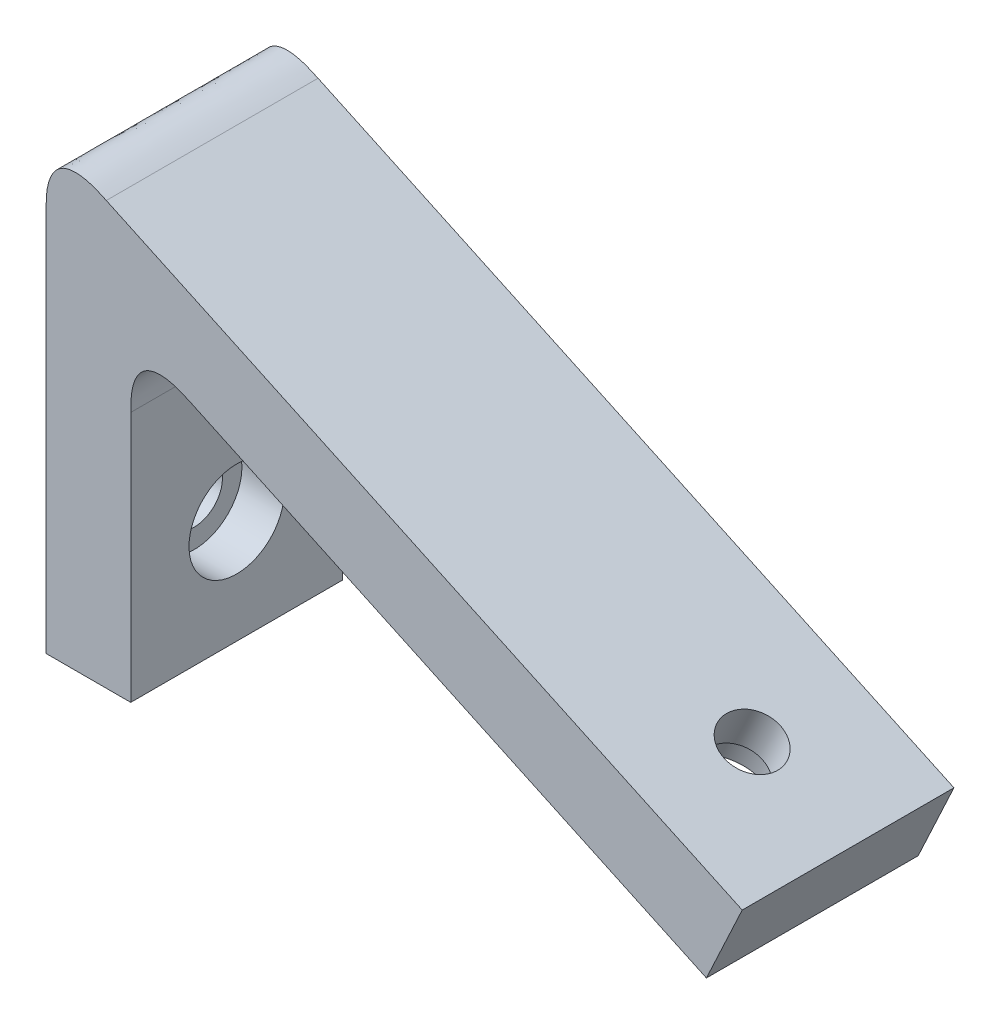
from build123d import *

# Parameters (mm, degrees)
BOSS_EXTRUDE1_DEPTH         = 25.4
F_1_4_CLEARANCE_HOLE1_D     = 6.7564
F_1_4_CLEARANCE_HOLE1_DEPTH = 10.16
F_1_4_CLEARANCE_HOLE1_TIP   = 2.029827343
F_1_4_CLEARANCE_HOLE2_D     = 6.7564
F_1_4_CLEARANCE_HOLE2_DEPTH = 10.16
F_1_4_CLEARANCE_HOLE2_TIP   = 2.029827343
SKETCH8_R                   = 5.715
CUT_EXTRUDE1_DEPTH          = 5.08
SKETCH9_R                   = 5.715
CUT_EXTRUDE2_DEPTH          = 5.08


with BuildPart() as part:
    # Sketch1 → Boss-Extrude1 (new body)
    with BuildSketch(Plane.XY):
        Polygon((10.16, 0), (0, 0), (0, 54.048005464), (83.514454911, 15.104575572), (79.220653372, 5.896488455), (10.16, 38.1), align=None)
    extrude(amount=BOSS_EXTRUDE1_DEPTH)

    # 1/4 Clearance Hole1
    with Locations(Plane.ZY):
        with Locations((12.7, 12.7)):
            Hole(F_1_4_CLEARANCE_HOLE1_D / 2, depth=F_1_4_CLEARANCE_HOLE1_DEPTH)
            with Locations((0, 0, -(F_1_4_CLEARANCE_HOLE1_DEPTH + F_1_4_CLEARANCE_HOLE1_TIP / 2))):  # 118° drill point
                Cone(0, F_1_4_CLEARANCE_HOLE1_D / 2, F_1_4_CLEARANCE_HOLE1_TIP, mode=Mode.SUBTRACT)

    # 1/4 Clearance Hole2
    with Locations(Plane(origin=(20.701587123, 44.394696852, 0), x_dir=(0.9063077870366483, -0.42261826174070316, 0), z_dir=(0.42261826174070316, 0.9063077870366483, 0))):
        with Locations((56.606331344, -12.7)):
            Hole(F_1_4_CLEARANCE_HOLE2_D / 2, depth=F_1_4_CLEARANCE_HOLE2_DEPTH)
            with Locations((0, 0, -(F_1_4_CLEARANCE_HOLE2_DEPTH + F_1_4_CLEARANCE_HOLE2_TIP / 2))):  # 118° drill point
                Cone(0, F_1_4_CLEARANCE_HOLE2_D / 2, F_1_4_CLEARANCE_HOLE2_TIP, mode=Mode.SUBTRACT)

    # Fillet1
    # a fillet whose section is not a circle: 5.08 mm, written as the material it adds along each edge (its section moved 0.00015 mm through the faces so that the kernel can cut it)
    with BuildSketch(Plane(origin=(10.16, 38.1, 0), x_dir=(0.9063157368032501, -0.4226012129925586, 0), z_dir=(0, 0, 1))) as fillet1_piece_1:
        with BuildLine():
            add(Edge.make_bspline([(7.974002733, 0), (6.748845081, 2.3047e-05), (5.523687428, 4.6093e-05), (2.911264627, -0.681700719), (1.848095837, -2.35047216), (2.334181059, -5.00626823), (2.851934169, -6.11664789), (3.369687279, -7.227027551)], knots=[0, 0, 0, 0, 0, 0, 0.5, 0.5, 1, 1, 1, 1, 1, 1], degree=5))
            Line((3.369687279, -7.227027551), (3.277605601, -7.269963835))
            ThreePointArc((3.277605601, -7.269963835), (1.592829935, -3.656418364), (-0.092081679, -0.042936283))
            Line((-0.092081679, -0.042936283), (1.911e-06, 0.1016))
            ThreePointArc((1.911e-06, 0.1016), (3.987003276, 0.101525), (7.974004644, 0.1016))
            Line((7.974004644, 0.1016), (7.974002733, 0))
        make_face()
    extrude(amount=25.4)
    # a fillet whose section is not a circle: 5.08 mm, written as the material it takes off along each edge (its section moved 0.00015 mm through the faces so that the kernel can cut it)
    with BuildSketch(Plane(origin=(0, 54.048005464, -19.935006833), x_dir=(-1.8811129744924416e-05, -0.9999999998230706, 0), z_dir=(0, 0, 1))) as fillet1_2_piece_1:
        with BuildLine():
            add(Edge.make_bspline([(7.974002733, 0), (6.748845081, -2.3047e-05), (5.523687428, -4.6093e-05), (2.911264627, 0.681700719), (1.848095837, 2.35047216), (2.334181059, 5.00626823), (2.851934169, 6.11664789), (3.369687279, 7.227027551)], knots=[0, 0, 0, 0, 0, 0, 0.5, 0.5, 1, 1, 1, 1, 1, 1], degree=5))
            Line((3.369687279, 7.227027551), (3.277605601, 7.269963835))
            ThreePointArc((3.277605601, 7.269963835), (1.592829935, 3.656418364), (-0.092081679, 0.042936283))
            Line((-0.092081679, 0.042936283), (1.911e-06, -0.1016))
            ThreePointArc((1.911e-06, -0.1016), (3.987003276, -0.101525), (7.974004644, -0.1016))
            Line((7.974004644, -0.1016), (7.974002733, 0))
        make_face()
    extrude(amount=65.270013666, mode=Mode.SUBTRACT)

    # Sketch8 → Cut-Extrude1 (cut)
    with BuildSketch(Plane(origin=(16.407785584, 35.186609736, 0), x_dir=(0.906307787036648, -0.42261826174070366, 0), z_dir=(-0.4226182617407036, -0.9063077870366479, 0))):
        with Locations((56.606331344, 12.7)):
            Circle(SKETCH8_R)
    extrude(amount=-CUT_EXTRUDE1_DEPTH, mode=Mode.SUBTRACT)

    # Sketch9 → Cut-Extrude2 (cut)
    with BuildSketch(Plane(origin=(10.16, 0, 0), x_dir=(0, 0, -1), z_dir=(1, 0, 0))):
        with Locations(Location((-12.7, 12.7, 0), (0, 0, 90))):
            Circle(SKETCH9_R)
    extrude(amount=-CUT_EXTRUDE2_DEPTH, mode=Mode.SUBTRACT)


solid = part.part
